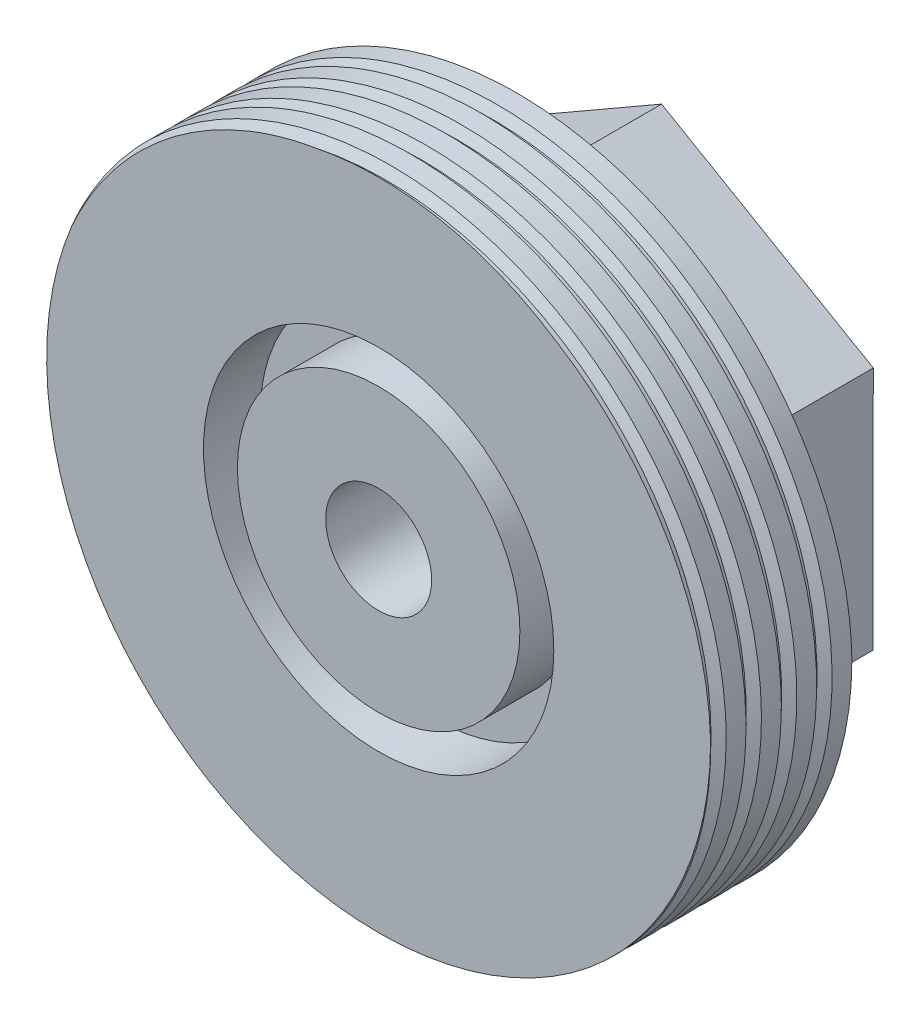
from build123d import *
from build123d.topology import SkipClean

# Parameters (mm, degrees)
SKETCH3_R           = 14.9225
BOSS_EXTRUDE1_DEPTH = 12.7
SKETCH11_R          = 2.38125
CUT_EXTRUDE3_DEPTH  = 6.35
SKETCH12_R          = 7.874
SKETCH12_R_2        = 6.35
CUT_EXTRUDE4_DEPTH  = 2.54
THREAD1_PITCH       = 1.5875
CUT_EXTRUDE5_START  = -6.35
SKETCH13_R          = 2.38125
CUT_EXTRUDE5_DEPTH  = 6.35
CUT_EXTRUDE6_START  = -6.35
SKETCH14_R          = 14.9225
CUT_EXTRUDE6_DEPTH  = 6.35


with BuildPart() as part:
    # Sketch3 → Boss-Extrude1 (new body)
    with BuildSketch(Plane.XY):
        with Locations((8.347593151, 27.723781851)):
            Circle(SKETCH3_R)
    extrude(amount=-BOSS_EXTRUDE1_DEPTH)

    # Sketch11 → Cut-Extrude3 (cut)
    with BuildSketch(Plane.XY):
        with Locations((8.347593151, 27.723781851)):
            Circle(SKETCH11_R)
    extrude(amount=-CUT_EXTRUDE3_DEPTH, mode=Mode.SUBTRACT)

    # Sketch12 → Cut-Extrude4 (cut)
    with BuildSketch(Plane.XY):
        with Locations((8.347593151, 27.723781851)):
            Circle(SKETCH12_R)
        with Locations((8.347593151, 27.723781851)):
            Circle(SKETCH12_R_2, mode=Mode.SUBTRACT)
    extrude(amount=-CUT_EXTRUDE4_DEPTH, mode=Mode.SUBTRACT)

    # Thread1: the profile of Thread Profile1 profile screwed along a right-hand helix of 4.8 turns, 8 arcs to a turn; built about Z, then put on its axis
    thread1_z = Axis((0, 0, 0), (0, 0, 1))
    thread1_corners = [(14.9228, 0, -0.000173205), (14.9228, 0, 0.694704453), (14.492870212, 0, 0.446484374), (14.492870212, 0, 0.248046874)]
    with BuildLine(mode=Mode.PRIVATE) as thread1_profile:
        Line(thread1_corners[0], thread1_corners[1])
        Line(thread1_corners[1], thread1_corners[2])
        Line(thread1_corners[2], thread1_corners[3])
        Line(thread1_corners[3], thread1_corners[0])
    thread1_cap = Face(thread1_profile.wire())
    thread1_turn_angles = [0, 22.5, 45, 67.5, 90, 112.5, 135, 157.5, 180, 202.5, 225, 247.5, 270, 292.5, 315, 337.5, 360]
    thread1_turn_weights = [1, 0.9238795325112867, 1, 0.9238795325112867, 1, 0.9238795325112867, 1, 0.9238795325112867, 1, 0.9238795325112867, 1, 0.9238795325112867, 1, 0.9238795325112867, 1, 0.9238795325112867, 1]
    thread1_turn_rails = [Edge.make_bspline([Vector(p[0], p[1], 0).rotate(thread1_z, thread1_turn_angles[k]) / thread1_turn_weights[k] + Vector(0, 0, p[2] + THREAD1_PITCH * thread1_turn_angles[k] / 360) for k in range(17)], [0, 0, 0, 1, 1, 2, 2, 3, 3, 4, 4, 5, 5, 6, 6, 7, 7, 8, 8, 8], 2, thread1_turn_weights) for p in thread1_corners]
    thread1_turn_sides = [Face.make_surface_from_curves(thread1_turn_rails[p[0]], thread1_turn_rails[p[1]]) for p in [(0, 1), (1, 2), (2, 3), (3, 0)]]
    thread1_last_angles = [1440, 1462.5, 1485, 1507.5, 1530, 1552.5, 1575, 1597.5, 1620, 1642.5, 1665, 1687.5, 1710, 1719, 1728]
    thread1_last_weights = [1, 0.9238795325112867, 1, 0.9238795325112867, 1, 0.9238795325112867, 1, 0.9238795325112867, 1, 0.9238795325112867, 1, 0.9238795325112867, 1, 0.9876883405951378, 1]
    thread1_last_rails = [Edge.make_bspline([Vector(p[0], p[1], 0).rotate(thread1_z, thread1_last_angles[k]) / thread1_last_weights[k] + Vector(0, 0, p[2] + THREAD1_PITCH * thread1_last_angles[k] / 360) for k in range(15)], [0, 0, 0, 1, 1, 2, 2, 3, 3, 4, 4, 5, 5, 6, 6, 7, 7, 7], 2, thread1_last_weights) for p in thread1_corners]
    thread1_last_sides = [Face.make_surface_from_curves(thread1_last_rails[p[0]], thread1_last_rails[p[1]]) for p in [(0, 1), (1, 2), (2, 3), (3, 0)]]
    thread1 = Plane(origin=(8.347593151, 27.723781851, 0.79375), x_dir=(-1, 0, 0), z_dir=(0, 0, -1)) * Solid(Shell([*[p.moved(Location((0, 0, THREAD1_PITCH * i))) for i in range(4) for p in thread1_turn_sides], *thread1_last_sides, thread1_cap, thread1_cap.rotate(thread1_z, 1728).moved(Location((0, 0, THREAD1_PITCH * 1728 / 360)))]))
    add(thread1, mode=Mode.SUBTRACT)

    # Sketch13 → Cut-Extrude5 (cut)
    with BuildSketch(Plane(origin=(0, 0, -12.7), x_dir=(-1, 0, 0), z_dir=(0, 0, -1)).offset(CUT_EXTRUDE5_START)):
        with Locations(Location((-8.347593151, 27.723781851, 0), (0, 0, 180))):
            Circle(SKETCH13_R)
    extrude(amount=CUT_EXTRUDE5_DEPTH, mode=Mode.SUBTRACT)

    # Sketch14 → Cut-Extrude6 (cut)
    with SkipClean():  # the faces are left unmerged after this step: merging them gives an invalid solid
        with BuildSketch(Plane(origin=(0, 0, -12.7), x_dir=(-1, 0, 0), z_dir=(0, 0, -1)).offset(CUT_EXTRUDE6_START)):
            with Locations((-8.347593151, 27.723781851)):
                Circle(SKETCH14_R)
            Polygon((1.186658464, 22.240576024), (1.168128197, 33.239083042), (-8.366123418, 38.722288869), (-17.881844766, 33.206987678), (-17.863314499, 22.20848066), (-8.329062884, 16.725274833), align=None, mode=Mode.SUBTRACT)
        extrude(amount=CUT_EXTRUDE6_DEPTH, mode=Mode.SUBTRACT)
    add(part.part.scale(1), mode=Mode.REPLACE)  # the faces are merged on a copy


solid = part.part
